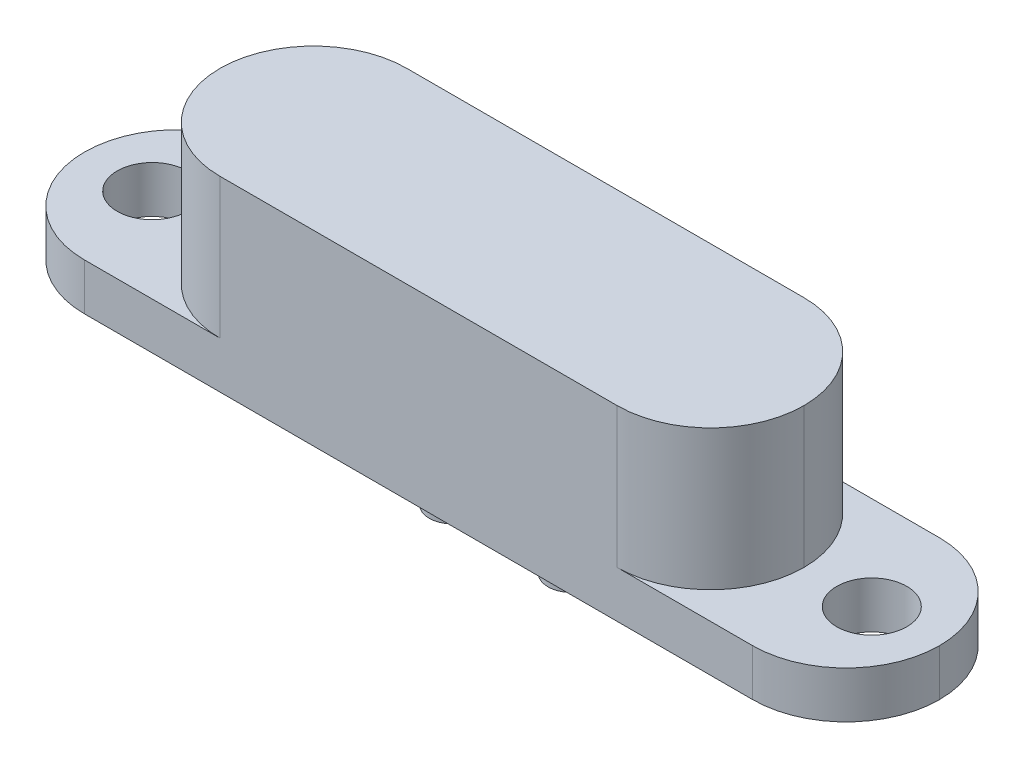
from build123d import *

# Parameters (mm, degrees)
SKETCH_1_W          = 12.5
SKETCH_1_H          = 4
EXTRUDE_1_DEPTH     = 4
FILLET_1_R          = 2
SKETCH_1_3_W        = 18.3
SKETCH_1_3_H        = 4
EXTRUDE_2_DEPTH     = 1
FILLET_2_R          = 2
SKETCH_2_R          = 0.75
CUT_EXTRUDE_1_DEPTH = 10.834759784
EXTRUDE_START       = -4
SKETCH_3_R          = 0.5
EXTRUDE_3_DEPTH     = 5.6
SKETCH_4_R          = 0.5
CUT_EXTRUDE_2_DEPTH = 0.1


with BuildPart() as part:
    # 草图1 → 凸台-拉伸1 (new body)
    with BuildSketch(Plane(origin=(0, 0, 0), x_dir=(1, 0, 0), z_dir=(0, 1, 0))):
        Rectangle(SKETCH_1_W, SKETCH_1_H)
    extrude(amount=EXTRUDE_1_DEPTH)

    # 圆角1
    fillet_1_edges = [part.edges().sort_by_distance(p)[0] for p in [
        (6.25, 2, -2),
        (6.25, 2, 2),
        (-6.25, 2, 2),
        (-6.25, 2, -2),
    ]]
    fillet(fillet_1_edges, radius=FILLET_1_R - 0.0001)  # a hair under: the kernel refuses the full size

    # 草图1<3> → 凸台-拉伸2 (add)
    with BuildSketch(Plane(origin=(0, 0, 0), x_dir=(1, 0, 0), z_dir=(0, 1, 0))):
        Rectangle(SKETCH_1_3_W, SKETCH_1_3_H)
    extrude(amount=EXTRUDE_2_DEPTH)

    # 圆角2
    fillet_2_edges = [part.edges().sort_by_distance(p)[0] for p in [
        (9.15, 0.5, 2),
        (9.15, 0.5, -2),
        (-9.15, 0.5, 2),
        (-9.15, 0.5, -2),
    ]]
    fillet(fillet_2_edges, radius=FILLET_2_R - 0.0001)  # a hair under: the kernel refuses the full size

    # 草图2 → 切除-拉伸1 (cut, through all)
    with BuildSketch(Plane(origin=(0, 1, 0), x_dir=(1, 0, 0), z_dir=(0, 1, 0))):
        with Locations(Location((-7.7, 0, 0), (0, 0, 270))):
            Circle(SKETCH_2_R)
        with Locations(Location((7.7, 0, 0), (0, 0, 270))):
            Circle(SKETCH_2_R)
    extrude(amount=-CUT_EXTRUDE_1_DEPTH, mode=Mode.SUBTRACT)

    # 草图3 → 凸台-拉伸3 (add)
    with BuildSketch(Plane.XZ.offset(EXTRUDE_START)):
        with Locations(Location((-1.27, 0, 0), (0, 0, 90))):
            Circle(SKETCH_3_R)
        with Locations(Location((1.27, 0, 0), (0, 0, 90))):
            Circle(SKETCH_3_R)
    extrude(amount=EXTRUDE_3_DEPTH)

    # 草图4 → 切除-拉伸2 (cut)
    with BuildSketch(Plane.XZ):
        with Locations(Location((0, 0, 0), (0, 0, 270))):
            Circle(SKETCH_4_R)
    extrude(amount=-CUT_EXTRUDE_2_DEPTH, mode=Mode.SUBTRACT)


solid = part.part
